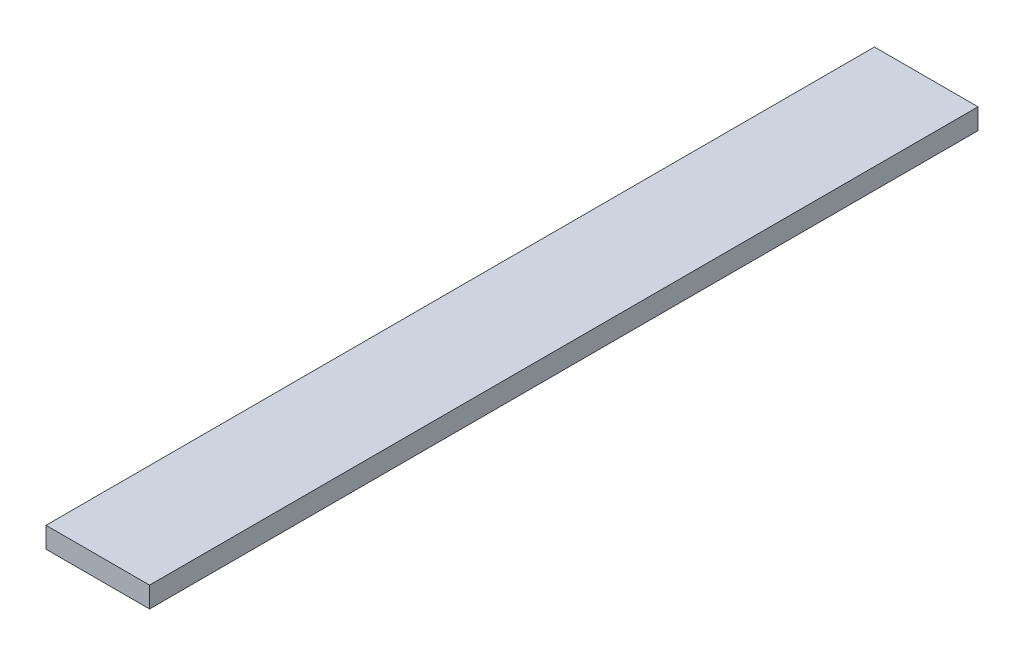
from build123d import *

# Parameters (mm, degrees)
SKETCH1_W           = 15
SKETCH1_H           = 120
BOSS_EXTRUDE1_DEPTH = 3


with BuildPart() as part:
    # Sketch1 → Boss-Extrude1 (new body)
    with BuildSketch(Plane(origin=(0, 0, 0), x_dir=(1, 0, 0), z_dir=(0, 1, 0))):
        Rectangle(SKETCH1_W, SKETCH1_H)
    extrude(amount=BOSS_EXTRUDE1_DEPTH)


solid = part.part
